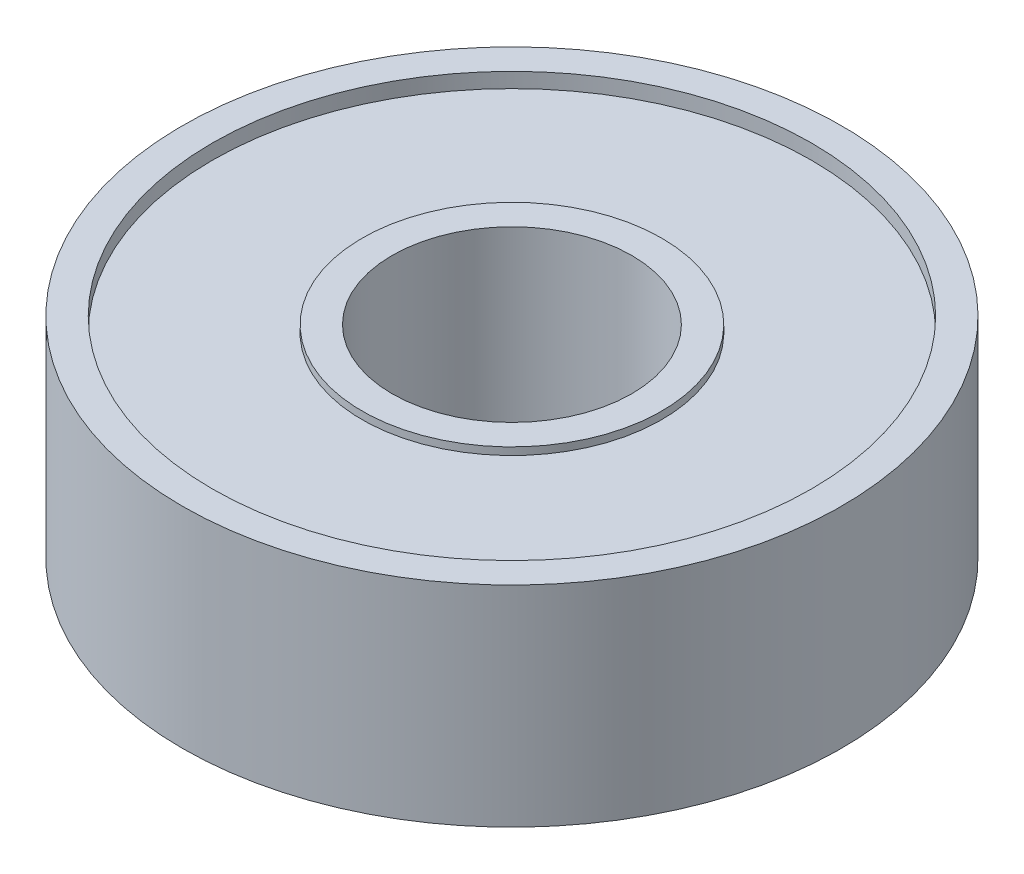
from build123d import *

# Parameters (mm, degrees)
SKETCH1_R           = 11
BOSS_EXTRUDE1_DEPTH = 3
SKETCH2_R           = 11
SKETCH2_R_2         = 10
BOSS_EXTRUDE2_DEPTH = 3.5
SKETCH4_R           = 5
BOSS_EXTRUDE3_DEPTH = 3.25
SKETCH5_R           = 4
CUT_EXTRUDE1_DEPTH  = 10


with BuildPart() as part:
    # Sketch1 → Boss-Extrude1 (new, symmetric)
    with BuildSketch(Plane(origin=(0, 0, 0), x_dir=(1, 0, 0), z_dir=(0, 1, 0))):
        Circle(SKETCH1_R)
    extrude(amount=BOSS_EXTRUDE1_DEPTH, both=True)

    # Sketch2 → Boss-Extrude2 (add, symmetric)
    with BuildSketch(Plane(origin=(0, 0, 0), x_dir=(1, 0, 0), z_dir=(0, 1, 0))):
        Circle(SKETCH2_R)
        Circle(SKETCH2_R_2, mode=Mode.SUBTRACT)
    extrude(amount=BOSS_EXTRUDE2_DEPTH, both=True)

    # Sketch4 → Boss-Extrude3 (add, symmetric)
    with BuildSketch(Plane(origin=(0, 0, 0), x_dir=(1, 0, 0), z_dir=(0, 1, 0))):
        Circle(SKETCH4_R)
    extrude(amount=BOSS_EXTRUDE3_DEPTH, both=True)

    # Sketch5 → Cut-Extrude1 (cut)
    with BuildSketch(Plane(origin=(0, 3.25, 0), x_dir=(1, 0, 0), z_dir=(0, 1, 0))):
        Circle(SKETCH5_R)
    extrude(amount=-CUT_EXTRUDE1_DEPTH, mode=Mode.SUBTRACT)


solid = part.part
